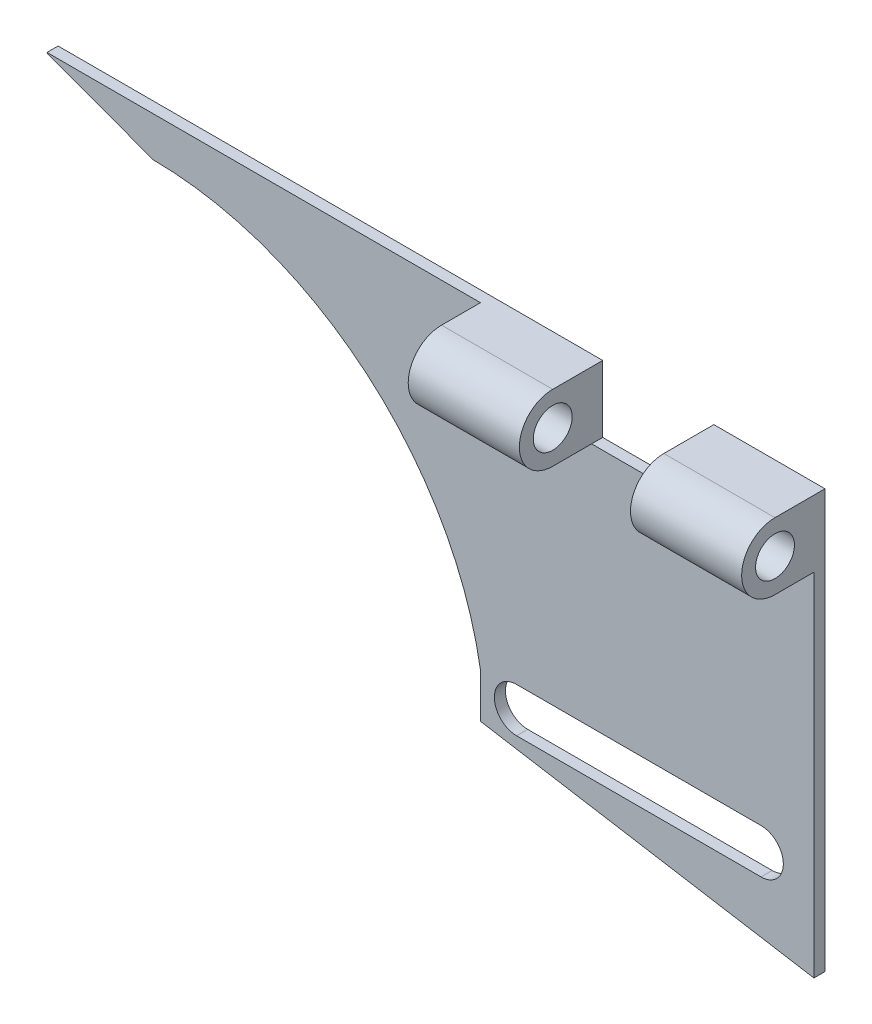
from build123d import *

# Parameters (mm, degrees)
BOSS_EXTRUDE1_DEPTH = 1
CUT_EXTRUDE1_DEPTH  = 40.307328833
BOSS_EXTRUDE2_DEPTH = 10
LPATTERN1_COUNT     = 2
LPATTERN1_PITCH     = 20
CUT_EXTRUDE2_REACH  = 73.91
SKETCH4_R           = 1.75
CUT_EXTRUDE3_REACH  = 41.829
SKETCH5_W           = 10
SKETCH5_H           = 6
CHAMFER1_START      = -11.379677933
CHAMFER1_OUTLINE_W  = 13
CHAMFER1_OUTLINE_H  = 2
CHAMFER1_DEPTH      = 16.961310673


with BuildPart() as part:
    # Sketch1 → Boss-Extrude1 (new body)
    with BuildSketch(Plane.XY):
        with BuildLine():
            Line((4.5, -13.81), (34.5, -18.81))
            Line((34.5, -18.81), (34.5, 18.81))
            Line((34.5, 18.81), (-34.5, 18.81))
            Line((-34.5, 18.81), (-34.5, 14.81))
            Line((-34.5, 14.81), (-26.5, 15.18758956))
            ThreePointArc((-26.5, 15.18758956), (-6.254140463, 8.574228065), (4.5, -9.81))
            Line((4.5, -9.81), (4.5, -13.81))
        make_face()
    extrude(amount=BOSS_EXTRUDE1_DEPTH)

    # Sketch2 → Cut-Extrude1 (cut, through all)
    with BuildSketch(Plane.XY.offset(1)):
        with BuildLine():
            Line((7.75, -9.31), (29.75, -9.31))
            ThreePointArc((29.75, -9.31), (31.75, -11.31), (29.75, -13.31))
            Line((29.75, -13.31), (7.75, -13.31))
            ThreePointArc((7.75, -13.31), (5.75, -11.31), (7.75, -9.31))
        make_face()
    extrude(amount=-CUT_EXTRUDE1_DEPTH, mode=Mode.SUBTRACT)

    # Sketch3 → Boss-Extrude2 (add)
    with BuildSketch(Plane(origin=(34.5, 0, 0), x_dir=(0, 0, -1), z_dir=(1, 0, 0))):
        with BuildLine():
            Line((-1, 18.81), (-4.5, 18.81))
            ThreePointArc((-4.5, 18.81), (-7.5, 15.81), (-4.5, 12.81))
            Line((-4.5, 12.81), (-1, 12.81))
            Line((-1, 12.81), (-1, 18.81))
        make_face()
    boss_extrude2 = extrude(amount=-BOSS_EXTRUDE2_DEPTH)

    # LPattern1: Boss-Extrude2 ×2
    with Locations(*[(-i * LPATTERN1_PITCH, 0, 0) for i in range(1, LPATTERN1_COUNT)]):
        add(boss_extrude2)

    # Cut-Extrude2: up to this face of the body (flat: up to its plane)
    cut_extrude2_end = Plane(part.part.faces().sort_by_distance((4.5, 15.81, 3.966377012))[0])
    # Sketch4 → Cut-Extrude2 (cut, up to the picked face)
    with BuildSketch(Plane(origin=(34.5, 0, 0), x_dir=(0, 0, -1), z_dir=(1, 0, 0)), mode=Mode.PRIVATE) as cut_extrude2_sk1:
        with Locations(Location((-4.5, 15.81, 0), (0, 0, 180))):
            Circle(SKETCH4_R)
    cut_extrude2_tool1 = split(extrude(cut_extrude2_sk1.sketch, amount=-CUT_EXTRUDE2_REACH, mode=Mode.PRIVATE), bisect_by=cut_extrude2_end, keep=Keep.BOTH, mode=Mode.PRIVATE)
    add(cut_extrude2_tool1.solids().sort_by(Axis((34.5, 15.81, 4.5), (-1, 0, 0)))[0], mode=Mode.SUBTRACT)

    # Sketch5 → Cut-Extrude3 (cut, up to next)
    with BuildSketch(Plane.XY.offset(1), mode=Mode.PRIVATE) as cut_extrude3_sk1:
        with Locations((19.5, 15.81)):
            Rectangle(SKETCH5_W, SKETCH5_H)
    cut_extrude3_tool1 = extrude(cut_extrude3_sk1.sketch, amount=-CUT_EXTRUDE3_REACH, mode=Mode.PRIVATE) & part.part
    add(cut_extrude3_tool1.solids().sort_by_distance((19.5, 15.81, 1))[0], mode=Mode.SUBTRACT)

    # Chamfer1: read off the stored shape, not the designer's step
    # Chamfer1 outline → Chamfer1 (cut)
    with BuildSketch(Plane(origin=(0, 0, 0), x_dir=(0.937451280255772, -0.34811649938894607, 0), z_dir=(0.34811649938894607, 0.9374512802557721, 0)).offset(CHAMFER1_START)):
        with Locations((-33.5, 0)):
            Rectangle(CHAMFER1_OUTLINE_W, CHAMFER1_OUTLINE_H)
    extrude(amount=CHAMFER1_DEPTH, mode=Mode.SUBTRACT)


solid = part.part
